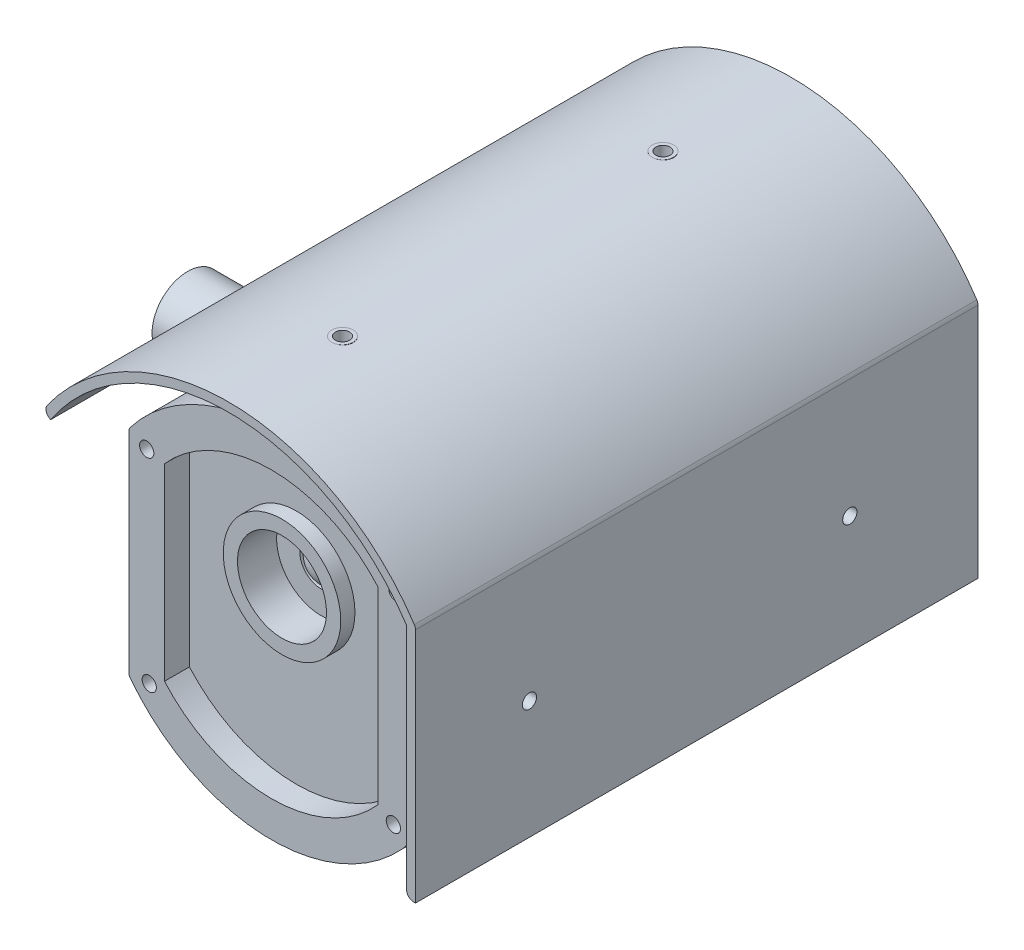
from build123d import *

# Parameters (mm, degrees)
BOSS_EXTRUDE1_DEPTH      = 140
CUT_EXTRUDE1_DEPTH       = 7
BOSS_EXTRUDE2_DEPTH      = 12
BOSS_EXTRUDE2_DEPTH_BACK = 146
SKETCH4_R                = 16.5
SKETCH4_R_2              = 12.5
BOSS_EXTRUDE3_DEPTH      = 4
CUT_EXTRUDE2_START       = -7
SKETCH5_R                = 12.5
CUT_EXTRUDE2_DEPTH       = 7
SKETCH6_R                = 6
CUT_EXTRUDE3_DEPTH       = 1
DOME1_FACE_RADIUS        = 6
DOME1_HEIGHT             = 3
SKETCH7_R                = 3
BOSS_EXTRUDE4_DEPTH      = 12.5
SKETCH8_R                = 2
CUT_EXTRUDE4_DEPTH       = 17
BOSS_EXTRUDE5_REACH      = 198.256
BOSS_EXTRUDE5_END_RADIUS = 50
SKETCH9_R                = 3
SKETCH10_R               = 2
CUT_EXTRUDE5_DEPTH       = 17
BOSS_EXTRUDE6_DEPTH      = 7
SKETCH12_W               = 70
SKETCH12_H               = 3.5
CUT_EXTRUDE6_DEPTH       = 5
SKETCH13_R               = 10
BOSS_EXTRUDE7_DEPTH      = 50
SKETCH14_R               = 15
SKETCH14_R_2             = 10
BOSS_EXTRUDE8_DEPTH      = 20
FILLET1_R                = 2
SKETCH15_R               = 2
CUT_EXTRUDE7_DEPTH       = 5
L_EK1_SCALE              = 0.1


with BuildPart() as part:
    # Sketch1 → Boss-Extrude1 (new body)
    with BuildSketch(Plane.XY):
        with BuildLine():
            Line((-40, -30), (-40, 30))
            ThreePointArc((-40, 30), (0, 50), (40, 30))
            Line((40, 30), (40, -30))
            ThreePointArc((40, -30), (0, -50), (-40, -30))
        make_face()
    extrude(amount=BOSS_EXTRUDE1_DEPTH)

    # Sketch2 → Cut-Extrude1 (cut)
    with BuildSketch(Plane.XY.offset(140)):
        with BuildLine():
            Line((-30, 26.457513111), (-30, -26.457513111))
            ThreePointArc((-30, -26.457513111), (0, -40), (30, -26.457513111))
            Line((30, -26.457513111), (30, 26.457513111))
            ThreePointArc((30, 26.457513111), (0, 40), (-30, 26.457513111))
        make_face()
    extrude(amount=-CUT_EXTRUDE1_DEPTH, mode=Mode.SUBTRACT)

    # Sketch4 → Boss-Extrude3 (add)
    with BuildSketch(Plane.XY.offset(133)):
        with Locations((0, 10)):
            Circle(SKETCH4_R)
        with Locations((0, 10)):
            Circle(SKETCH4_R_2, mode=Mode.SUBTRACT)
    extrude(amount=BOSS_EXTRUDE3_DEPTH)

    # Sketch5 → Cut-Extrude2 (cut)
    with BuildSketch(Plane.XY.offset(133).offset(CUT_EXTRUDE2_START)):
        with Locations((0, 10)):
            Circle(SKETCH5_R)
    extrude(amount=CUT_EXTRUDE2_DEPTH, mode=Mode.SUBTRACT)

    # Sketch6 → Cut-Extrude3 (cut)
    with BuildSketch(Plane.XY.offset(126)):
        with Locations((0, 10)):
            Circle(SKETCH6_R)
    extrude(amount=-CUT_EXTRUDE3_DEPTH, mode=Mode.SUBTRACT)

    # Dome1: a dome of height H over a round flat face of radius A is a cap of a sphere of radius (A * A + H * H) / (2 * H)
    dome1_r = (DOME1_FACE_RADIUS * DOME1_FACE_RADIUS + DOME1_HEIGHT * DOME1_HEIGHT) / (2 * DOME1_HEIGHT)
    dome1_base = Plane((0, 10, 125), z_dir=(0, 0, 1))
    with Locations(dome1_base.offset(DOME1_HEIGHT - dome1_r)):
        dome1_ball = Sphere(dome1_r, mode=Mode.PRIVATE)
    add(split(dome1_ball, bisect_by=dome1_base, keep=Keep.TOP, mode=Mode.PRIVATE))



with BuildPart() as body_2:
    # Sketch3 → Boss-Extrude2 (new, two sides: drawn at the far end of the back side and taken through both)
    with BuildSketch(Plane.XY.offset(140).offset(-BOSS_EXTRUDE2_DEPTH_BACK)):
        with BuildLine():
            Line((52.5, -33.166247904), (52.5, 33.911649916))
            ThreePointArc((52.5, 33.911649916), (0.380386371, 62.498842439), (-52.083333333, 34.5481749))
            Line((-52.083333333, 34.5481749), (-50, 33.166247904))
            ThreePointArc((-50, 33.166247904), (0, 60), (50, 33.166247904))
            Line((50, 33.166247904), (50, -33.166247904))
            Line((50, -33.166247904), (52.5, -33.166247904))
        make_face()
    extrude(amount=BOSS_EXTRUDE2_DEPTH + BOSS_EXTRUDE2_DEPTH_BACK)


with BuildPart() as part_1:
    add(part.part)

    add(body_2.part)  # Boss-Extrude4 merges body 2
    # Sketch7 → Boss-Extrude4 (add)
    with BuildSketch(Plane(origin=(52.5, 0, 0), x_dir=(0, 0, -1), z_dir=(1, 0, 0))):
        with Locations(Location((-120, 0, 0), (0, 0, 270))):
            Circle(SKETCH7_R)
        with Locations(Location((-30, 0, 0), (0, 0, 270))):
            Circle(SKETCH7_R)
    extrude(amount=-BOSS_EXTRUDE4_DEPTH)

    # Sketch8 → Cut-Extrude4 (cut)
    with BuildSketch(Plane(origin=(52.5, 0, 0), x_dir=(0, 0, -1), z_dir=(1, 0, 0))):
        with Locations((-120, 0)):
            Circle(SKETCH8_R)
        with Locations((-30, 0)):
            Circle(SKETCH8_R)
    extrude(amount=-CUT_EXTRUDE4_DEPTH, mode=Mode.SUBTRACT)

    # Boss-Extrude5: up to this cylinder (the profile starts outside it)
    boss_extrude5_end = Plane(origin=(0, 0, 75), z_dir=(0, 0, -1)) * Cylinder(BOSS_EXTRUDE5_END_RADIUS, 587.512, mode=Mode.PRIVATE)
    # Sketch9 → Boss-Extrude5 (add, up to the surface)
    with BuildSketch(Plane(origin=(0, 62.5, 0), x_dir=(-1, 0, 0), z_dir=(0, 1, 0)), mode=Mode.PRIVATE) as boss_extrude5_sk1:
        with Locations(Location((0, 120, 0), (0, 0, 90))):
            Circle(SKETCH9_R)
    boss_extrude5_tool1 = extrude(boss_extrude5_sk1.sketch, amount=-BOSS_EXTRUDE5_REACH, mode=Mode.PRIVATE) - boss_extrude5_end
    add(boss_extrude5_tool1.solids().sort_by_distance((0, 62.5, 120))[0])
    # Sketch9 → Boss-Extrude5 (add, up to the surface)
    with BuildSketch(Plane(origin=(0, 62.5, 0), x_dir=(-1, 0, 0), z_dir=(0, 1, 0)), mode=Mode.PRIVATE) as boss_extrude5_sk2:
        with Locations(Location((0, 30, 0), (0, 0, 90))):
            Circle(SKETCH9_R)
    boss_extrude5_tool2 = extrude(boss_extrude5_sk2.sketch, amount=-BOSS_EXTRUDE5_REACH, mode=Mode.PRIVATE) - boss_extrude5_end
    add(boss_extrude5_tool2.solids().sort_by_distance((0, 62.5, 30))[0])

    # Sketch10 → Cut-Extrude5 (cut)
    with BuildSketch(Plane(origin=(0, 62.5, 0), x_dir=(1, 0, 0), z_dir=(0, 1, 0))):
        with Locations(Location((0, -30, 0), (0, 0, 270))):
            Circle(SKETCH10_R)
        with Locations(Location((0, -120, 0), (0, 0, 270))):
            Circle(SKETCH10_R)
    extrude(amount=-CUT_EXTRUDE5_DEPTH, mode=Mode.SUBTRACT)

    # Sketch11 → Boss-Extrude6 (add)
    with BuildSketch(Plane(origin=(0, 0, 0), x_dir=(-1, 0, 0), z_dir=(0, 0, -1))):
        with BuildLine():
            Line((-42, 30.659419434), (-42, -30.659419434))
            ThreePointArc((-42, -30.659419434), (0, -52), (42, -30.659419434))
            Line((42, -30.659419434), (42, 30.659419434))
            ThreePointArc((42, 30.659419434), (0, 52), (-42, 30.659419434))
        make_face()
        with BuildLine():
            Line((-40, 30), (-40, -30))
            ThreePointArc((-40, -30), (0, -50), (40, -30))
            Line((40, -30), (40, 30))
            ThreePointArc((40, 30), (0, 50), (-40, 30))
        make_face(mode=Mode.SUBTRACT)
    extrude(amount=-BOSS_EXTRUDE6_DEPTH)

    # Sketch12 → Cut-Extrude6 (cut)
    with BuildSketch(Plane(origin=(0, 0, 0), x_dir=(-1, 0, 0), z_dir=(0, 0, -1))):
        with BuildLine():
            ThreePointArc((16.155494421, 42), (0, 45), (-16.155494421, 42))
            Line((-16.155494421, 42), (16.155494421, 42))
        make_face()
        with BuildLine():
            ThreePointArc((-21.558061137, 39.5), (-24.342017693, 37.84793488), (-27, 36))
            Line((-27, 36), (27, 36))
            ThreePointArc((27, 36), (24.342017693, 37.84793488), (21.558061137, 39.5))
            Line((21.558061137, 39.5), (-21.558061137, 39.5))
        make_face()
        with BuildLine():
            ThreePointArc((-30.045798375, 33.5), (-31.841535092, 31.798060365), (-33.541019662, 30))
            Line((-33.541019662, 30), (33.541019662, 30))
            ThreePointArc((33.541019662, 30), (31.841535092, 31.798060365), (30.045798375, 33.5))
            Line((30.045798375, 33.5), (-30.045798375, 33.5))
        make_face()
        with Locations((0, 25.75)):
            Rectangle(SKETCH12_W, SKETCH12_H)
        with Locations((0, 19.75)):
            Rectangle(SKETCH12_W, SKETCH12_H)
        with Locations((0, 13.75)):
            Rectangle(SKETCH12_W, SKETCH12_H)
        with Locations((0, 7.75)):
            Rectangle(SKETCH12_W, SKETCH12_H)
        with Locations((0, 1.75)):
            Rectangle(SKETCH12_W, SKETCH12_H)
        with Locations((0, -4.25)):
            Rectangle(SKETCH12_W, SKETCH12_H)
        with Locations((0, -10.25)):
            Rectangle(SKETCH12_W, SKETCH12_H)
        with Locations((0, -16.25)):
            Rectangle(SKETCH12_W, SKETCH12_H)
        with Locations((0, -22.25)):
            Rectangle(SKETCH12_W, SKETCH12_H)
        with BuildLine():
            Line((35, -26.5), (-35, -26.5))
            Line((-35, -26.5), (-35, -28.284271247))
            ThreePointArc((-35, -28.284271247), (-34.281245243, -29.151264546), (-33.541019662, -30))
            Line((-33.541019662, -30), (33.541019662, -30))
            ThreePointArc((33.541019662, -30), (34.281245243, -29.151264546), (35, -28.284271247))
            Line((35, -28.284271247), (35, -26.5))
        make_face()
        with BuildLine():
            Line((31.124748995, -32.5), (-31.124748995, -32.5))
            ThreePointArc((-31.124748995, -32.5), (-29.115015223, -34.31203708), (-27, -36))
            Line((-27, -36), (27, -36))
            ThreePointArc((27, -36), (29.115015223, -34.31203708), (31.124748995, -32.5))
        make_face()
        with BuildLine():
            Line((23.296995514, -38.5), (-23.296995514, -38.5))
            ThreePointArc((-23.296995514, -38.5), (-19.803717846, -40.408077899), (-16.155494421, -42))
            Line((-16.155494421, -42), (16.155494421, -42))
            ThreePointArc((16.155494421, -42), (19.803717846, -40.408077899), (23.296995514, -38.5))
        make_face()
    extrude(amount=-CUT_EXTRUDE6_DEPTH, mode=Mode.SUBTRACT)

    # Sketch13 → Boss-Extrude7 (add)
    with BuildSketch(Plane.ZY.offset(40)):
        with Locations(Location((73.5, 0, 0), (0, 0, 90))):
            Circle(SKETCH13_R)
    extrude(amount=BOSS_EXTRUDE7_DEPTH)

    # Sketch14 → Boss-Extrude8 (add)
    with BuildSketch(Plane.ZY.offset(40)):
        with Locations(Location((73.5, 0, 0), (0, 0, 90))):
            Circle(SKETCH14_R)
        with Locations(Location((73.5, 0, 0), (0, 0, 270))):
            Circle(SKETCH14_R_2, mode=Mode.SUBTRACT)
    extrude(amount=BOSS_EXTRUDE8_DEPTH)

    # Fillet1
    fillet1_edges = [part_1.edges().sort_by_distance(p)[0] for p in [
        (50, -33.166247904, 73),
        (-52.083333333, 34.5481749, 73),
        (52.5, 33.911649916, 73),
        (42, 30.659419434, 3.5),
        (-42, 30.659419434, 3.5),
        (-42, -30.659419434, 3.5),
        (42, -30.659419434, 3.5),
        (0, 52, 0),
        (42, 0, 0),
        (0, -52, 0),
        (-42, 0, 0),
        (-40, -15, 73.5),
        (50, 3, 120),
        (40, 3, 120),
        (40, 30, 73.5),
        (-40, 30, 73.5),
        (-40, -30, 73.5),
        (40, -30, 73.5),
        (50, 3, 30),
        (40, 3, 30),
        (-2e-09, 60.000000006, 117.000000018),
        (-2e-09, 50.000000007, 117.000000018),
        (0, 59.999999997, 26.999999988),
        (0, 49.999999997, 26.999999988),
    ]]
    fillet(fillet1_edges, radius=FILLET1_R)

    # Sketch15 → Cut-Extrude7 (cut)
    with BuildSketch(Plane.XY.offset(140)):
        with Locations((35, 27.5)):
            Circle(SKETCH15_R)
        with Locations((-35, 27.5)):
            Circle(SKETCH15_R)
        with Locations((34.281245243, -29.151264546)):
            Circle(SKETCH15_R)
        with Locations((-34.281245243, -29.151264546)):
            Circle(SKETCH15_R)
    extrude(amount=-CUT_EXTRUDE7_DEPTH, mode=Mode.SUBTRACT)


with BuildPart() as part_2:
    # Ölçek1: scaled about (-0.046853804, 2.377259322, 69.044131571)
    add(part_1.part.scale(L_EK1_SCALE).moved(Location((-0.042168424, 2.13953339, 62.139718414))))


solid = part_2.part
